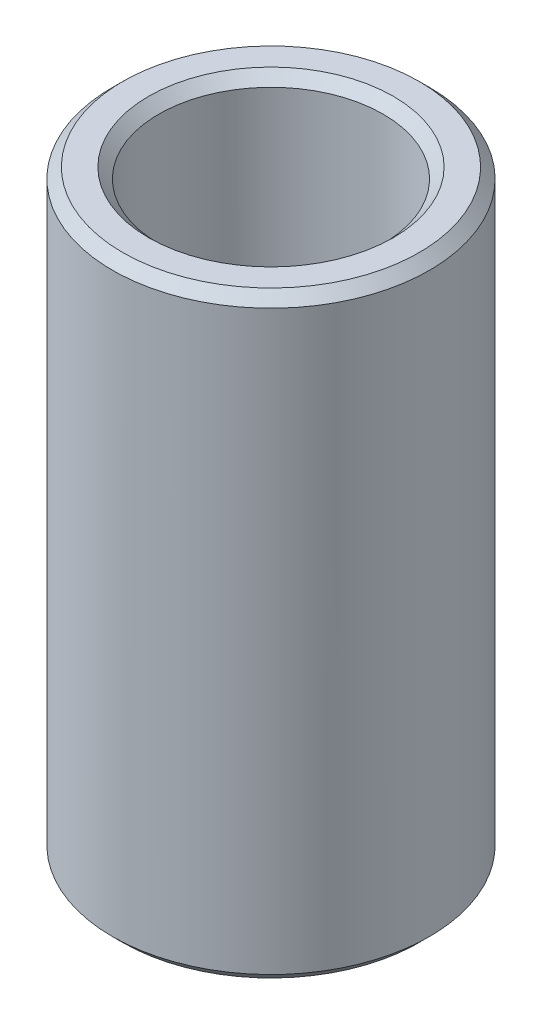
from build123d import *

# Parameters (mm, degrees)
SKETCH1_R           = 32.5
BOSS_EXTRUDE1_DEPTH = 122.542267193
SKETCH2_R           = 23.000609245
CUT_EXTRUDE1_DEPTH  = 131.878215333
CHAMFER1_SIZE       = 2.104162101


with BuildPart() as part:
    # Sketch1 → Boss-Extrude1 (new body)
    with BuildSketch(Plane(origin=(0, 0, 0), x_dir=(1, 0, 0), z_dir=(0, 1, 0))):
        Circle(SKETCH1_R)
    extrude(amount=BOSS_EXTRUDE1_DEPTH)

    # Sketch2 → Cut-Extrude1 (cut, through all)
    with BuildSketch(Plane(origin=(0, 0, 0), x_dir=(1, 0, 0), z_dir=(0, 1, 0))):
        Circle(SKETCH2_R)
    extrude(amount=CUT_EXTRUDE1_DEPTH, mode=Mode.SUBTRACT)

    # Chamfer1
    chamfer1_edges = [part.edges().sort_by_distance(p)[0] for p in [
        (-23.000609245, 122.542267193, 0),
        (-23.000609245, 0, 0),
        (-32.5, 0, 0),
        (-32.5, 122.542267193, 0),
    ]]
    chamfer(chamfer1_edges, length=CHAMFER1_SIZE)


solid = part.part
